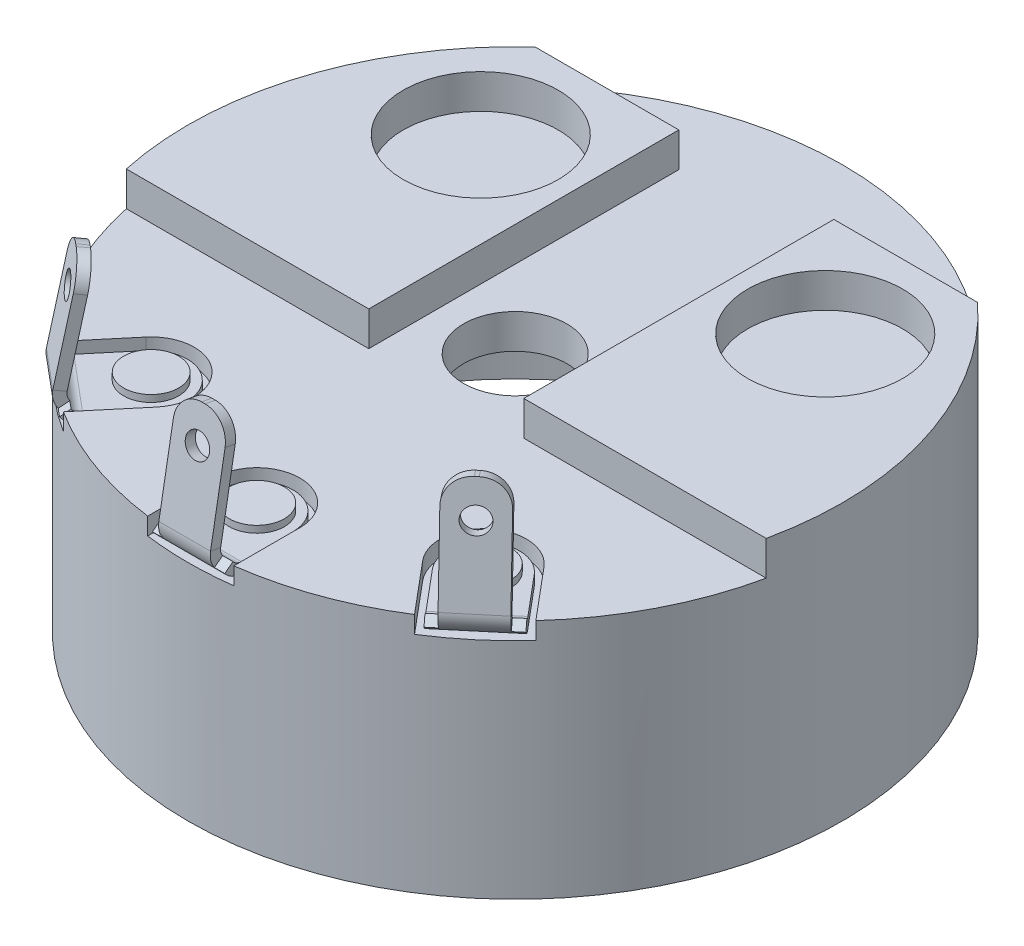
from build123d import *

# Parameters (mm, degrees)
SKETCH1_R                  = 4.75
SKETCH1_R_2                = 0.75
BOSS_EXTRUDE1_DEPTH        = 0.5
BOSS_EXTRUDE2_START        = 0.5
SKETCH1_3_R                = 1.125
BOSS_EXTRUDE2_DEPTH        = 0.5
SKETCH2_R                  = 0.375
CUT_EXTRUDE1_DEPTH         = 7.736096793
CUT_EXTRUDE2_DEPTH         = 0.25
CIRPATTERN2_COUNT          = 3
CIRPATTERN2_ANGLE          = 80
EXTRUDE_THIN2_START        = -0.5
SKETCH1_5_R                = 4.75
SKETCH1_5_R_2              = 4.5
EXTRUDE_THIN2_DEPTH        = 3
BASE_FLANGE2_START         = 0.15
SKETCH6_R                  = 0.175
SKETCH6_R_2                = 0.375
BASE_FLANGE2_DEPTH         = 0.15
SKETCHED_START             = -0.525
SKETCHED_BEND1_DEPTH       = 1.05
SKETCHED_BEND1_2_DEPTH     = 0.15
SKETCHED_START_2           = 0.375
SKETCHED_BEND1_3_DEPTH     = 0.15
SKETCHED_BEND1_4_DEPTH     = 1.05
SKETCHED_START_3           = -0.375
SKETCHED_BEND1_5_DEPTH     = 0.75
SKETCHED_START_4           = -4.741475404
SKETCHED_BEND1_6_OUTLINE_R = 0.175
SKETCHED_BEND1_6_DEPTH     = 0.149999999
SKETCH16_R                 = 0.375
BASE_FLANGE3_DEPTH         = 0.15
CIRPATTERN3_COUNT          = 3
CIRPATTERN3_ANGLE          = 80


with BuildPart() as part:
    # Sketch1 → Boss-Extrude1 (new body)
    with BuildSketch(Plane(origin=(0, 0, 0), x_dir=(1, 0, 0), z_dir=(0, 1, 0))):
        with Locations(Location((0, 0, 0), (0, 0, 270))):
            Circle(SKETCH1_R)
        with Locations(Location((0, 0, 0), (0, 0, 270))):
            Circle(SKETCH1_R_2, mode=Mode.SUBTRACT)
    extrude(amount=-BOSS_EXTRUDE1_DEPTH)

    # Sketch1<3> → Boss-Extrude2 (add)
    # profile 1 of 2: a face of its own
    with BuildSketch(Plane(origin=(0, 0, 0), x_dir=(1, 0, 0), z_dir=(0, 1, 0)).offset(BOSS_EXTRUDE2_START)):
        with BuildLine():
            ThreePointArc((-3.211308145, 3.5), (-4.526276083, 1.440598771), (-4.643543905, -1))
            Line((-4.643543905, -1), (-1.125, -1))
            Line((-1.125, -1), (-1.125, 3.5))
            Line((-1.125, 3.5), (-3.211308145, 3.5))
        make_face()
        with Locations(Location((-2.5, 2, 0), (0, 0, 270))):
            Circle(SKETCH1_3_R, mode=Mode.SUBTRACT)
    # profile 2 of 2: a face of its own
    with BuildSketch(Plane(origin=(0, 0, 0), x_dir=(1, 0, 0), z_dir=(0, 1, 0)).offset(BOSS_EXTRUDE2_START)):
        with BuildLine():
            Line((1.125, -1), (4.643543905, -1))
            ThreePointArc((4.643543905, -1), (4.723310997, -0.502825243), (4.75, 0))
            ThreePointArc((4.75, 0), (4.348345299, 1.911646713), (3.211308145, 3.5))
            Line((3.211308145, 3.5), (1.125, 3.5))
            Line((1.125, 3.5), (1.125, -1))
        make_face()
        with Locations(Location((2.5, 2, 0), (0, 0, 270))):
            Circle(SKETCH1_3_R, mode=Mode.SUBTRACT)
    extrude(amount=-BOSS_EXTRUDE2_DEPTH)

    # Sketch2 → Cut-Extrude1 (cut, through all)
    with BuildSketch(Plane(origin=(0, 0, 0), x_dir=(1, 0, 0), z_dir=(0, 1, 0))):
        with Locations(Location((-2.410453536, -2.872666662, 0), (0, 0, 270))):
            Circle(SKETCH2_R)
    cut_extrude1 = extrude(amount=-CUT_EXTRUDE1_DEPTH, mode=Mode.SUBTRACT)

    # Sketch2<3> → Cut-Extrude2 (cut)
    with BuildSketch(Plane(origin=(0, 0, 0), x_dir=(1, 0, 0), z_dir=(0, 1, 0))):
        with BuildLine():
            Line((-3.505473113, -3.205332784), (-2.889231313, -2.470924406))
            ThreePointArc((-2.889231313, -2.470924406), (-2.00871128, -2.393888885), (-1.931675759, -3.274408918))
            Line((-1.931675759, -3.274408918), (-2.547917559, -4.008817296))
            ThreePointArc((-2.547917559, -4.008817296), (-3.053241146, -3.638711105), (-3.505473113, -3.205332784))
        make_face()
    cut_extrude2 = extrude(amount=-CUT_EXTRUDE2_DEPTH, mode=Mode.SUBTRACT)

    # CirPattern2: Cut-Extrude1, Cut-Extrude2 ×3 about axis
    cirpattern2_axis = Axis((0, 0, 0), (0, 1, 0))
    add([cut_extrude1.rotate(cirpattern2_axis, i * CIRPATTERN2_ANGLE / (CIRPATTERN2_COUNT - 1)) for i in range(1, CIRPATTERN2_COUNT)], mode=Mode.SUBTRACT)
    add([cut_extrude2.rotate(cirpattern2_axis, i * CIRPATTERN2_ANGLE / (CIRPATTERN2_COUNT - 1)) for i in range(1, CIRPATTERN2_COUNT)], mode=Mode.SUBTRACT)

    # Sketch1<5> → Extrude-Thin2 (add)
    with BuildSketch(Plane(origin=(0, 0, 0), x_dir=(1, 0, 0), z_dir=(0, 1, 0)).offset(EXTRUDE_THIN2_START)):
        Circle(SKETCH1_5_R)
        Circle(SKETCH1_5_R_2, mode=Mode.SUBTRACT)
    extrude(amount=-EXTRUDE_THIN2_DEPTH)


with BuildPart() as body_2:
    # Base-Flange2: sheet metal written as solids
    # Sketch6 → Base-Flange2 (new body)
    with BuildSketch(Plane(origin=(0, -0.25, 0), x_dir=(1, 0, 0), z_dir=(0, 1, 0)).offset(BASE_FLANGE2_START)):
        with BuildLine():
            Line((-3.428868668, -3.269611545), (-2.812626869, -2.535203167))
            ThreePointArc((-2.812626869, -2.535203167), (-2.072990041, -2.470493329), (-2.008280204, -3.210130157))
            Line((-2.008280204, -3.210130157), (-2.624522003, -3.944538535))
            Line((-2.624522003, -3.944538535), (-2.73942867, -3.848120394))
            Line((-2.73942867, -3.848120394), (-3.639331323, -4.920582614))
            ThreePointArc((-3.639331323, -4.920582614), (-3.876942368, -5.044275095), (-4.132422542, -4.963722506))
            Line((-4.132422542, -4.963722506), (-4.170724764, -4.931583125))
            ThreePointArc((-4.170724764, -4.931583125), (-4.294417245, -4.69397208), (-4.213864655, -4.438491907))
            Line((-4.213864655, -4.438491907), (-3.313962002, -3.366029686))
            Line((-3.313962002, -3.366029686), (-3.428868668, -3.269611545))
        make_face()
        with Locations(Location((-3.830179848, -4.564630594, 0), (0, 0, 270))):
            Circle(SKETCH6_R, mode=Mode.SUBTRACT)
        with Locations(Location((-2.410453536, -2.872666662, 0), (0, 0, 270))):
            Circle(SKETCH6_R_2, mode=Mode.SUBTRACT)
    extrude(amount=-BASE_FLANGE2_DEPTH)

    # Sketched Bend1: read off the stored shape, not the designer's step
    # Sketched Bend1 outline → Sketched Bend1 (cut)
    with BuildSketch(Plane(origin=(0, 0, 0), x_dir=(0.642787609686532, 0, -0.7660444431189841), z_dir=(0.7660444431189841, 0, 0.6427876096865321)).offset(SKETCHED_START)):
        with BuildLine():
            Line((-4.760983594, -0.1), (-6.45870205, -0.1))
            Line((-6.45870205, -0.1), (-6.45870205, -0.25))
            Line((-6.45870205, -0.25), (-4.501175973, -0.25))
            ThreePointArc((-4.501175973, -0.25), (-4.651175973, -0.209807621), (-4.760983594, -0.1))
        make_face()
    extrude(amount=SKETCHED_BEND1_DEPTH, mode=Mode.SUBTRACT)

    # Sketched Bend1 2 outline → Sketched Bend1 2 (cut)
    with BuildSketch(Plane(origin=(0, 0, 0), x_dir=(0.642787609686532, 0, -0.7660444431189841), z_dir=(0.7660444431189841, 0, 0.6427876096865321)).offset(SKETCHED_START)):
        Polygon((-4.70870205, -0.107257954), (-4.699124063, -0.1), (-4.70870205, -0.1), align=None)
    extrude(amount=SKETCHED_BEND1_2_DEPTH, mode=Mode.SUBTRACT)

    # Sketched Bend1 3 outline → Sketched Bend1 3 (cut)
    with BuildSketch(Plane(origin=(0, 0, 0), x_dir=(0.642787609686532, 0, -0.7660444431189841), z_dir=(0.7660444431189841, 0, 0.6427876096865321)).offset(SKETCHED_START_2)):
        Polygon((-4.70870205, -0.107257954), (-4.699124063, -0.1), (-4.70870205, -0.1), align=None)
    extrude(amount=SKETCHED_BEND1_3_DEPTH, mode=Mode.SUBTRACT)

    # Sketched Bend1 4 outline → Sketched Bend1 4 (add)
    with BuildSketch(Plane(origin=(0, 0, 0), x_dir=(0.642787609686532, 0, -0.7660444431189841), z_dir=(0.7660444431189841, 0, 0.6427876096865321)).offset(SKETCHED_START)):
        with BuildLine():
            ThreePointArc((-4.501175973, -0.1), (-4.567925274, -0.084329932), (-4.620728362, -0.040593743))
            Line((-4.620728362, -0.040593743), (-4.699124063, -0.1))
            Line((-4.699124063, -0.1), (-4.501175973, -0.1))
        make_face()
        with BuildLine():
            Line((-4.70870205, -0.166640087), (-4.70870205, -0.107257954))
            Line((-4.70870205, -0.107257954), (-4.740280751, -0.131187486))
            ThreePointArc((-4.740280751, -0.131187486), (-4.725193834, -0.149539465), (-4.70870205, -0.166640087))
        make_face()
    extrude(amount=SKETCHED_BEND1_4_DEPTH)

    # Sketched Bend1 5 outline → Sketched Bend1 5 (add)
    with BuildSketch(Plane(origin=(0, 0, 0), x_dir=(0.642787609686532, 0, -0.7660444431189841), z_dir=(0.7660444431189841, 0, 0.6427876096865321)).offset(SKETCHED_START_3)):
        with BuildLine():
            ThreePointArc((-4.620728362, -0.040593743), (-4.646984295, 0.014787316), (-4.648897136, 0.076047227))
            Line((-4.648897136, 0.076047227), (-4.377167779, 1.617100985))
            Line((-4.377167779, 1.617100985), (-4.524888942, 1.643148211))
            Line((-4.524888942, 1.643148211), (-4.796618299, 0.102094453))
            ThreePointArc((-4.796618299, 0.102094453), (-4.796618299, -0.002094454), (-4.760983594, -0.1))
            Line((-4.760983594, -0.1), (-4.699124063, -0.1))
            Line((-4.699124063, -0.1), (-4.620728362, -0.040593743))
        make_face()
    extrude(amount=SKETCHED_BEND1_5_DEPTH)

    # Sketched Bend1 6 outline → Sketched Bend1 6 (cut)
    with BuildSketch(Plane(origin=(0, 0, 0), x_dir=(0.7741336234862156, 0.1419950663058049, 0.6168910228986253), z_dir=(0.6330222215594821, -0.17364817766693402, -0.7544065067354941)).offset(SKETCHED_START_4)):
        with BuildLine():
            Line((-0.251054745, -0.877817458), (0.095287988, -0.827352508))
            ThreePointArc((0.095287988, -0.827352508), (-0.164394149, -0.761595178), (-0.301519694, -0.531474724))
            Line((-0.301519694, -0.531474724), (-0.251054745, -0.877817458))
        make_face()
        with BuildLine():
            ThreePointArc((0.440643306, -0.423335547), (0.374885975, -0.683017684), (0.144765522, -0.82014323))
            Line((0.144765522, -0.82014323), (0.491108255, -0.769678281))
            Line((0.491108255, -0.769678281), (0.440643306, -0.423335547))
        make_face()
        with Locations((0.04793397, -0.328972536)):
            Circle(SKETCHED_BEND1_6_OUTLINE_R)
    extrude(amount=SKETCHED_BEND1_6_DEPTH, mode=Mode.SUBTRACT)


with BuildPart() as body_3:
    # Base-Flange3: sheet metal written as solids
    # Sketch16 → Base-Flange3 (new body)
    with BuildSketch(Plane.XZ.offset(0.5)):
        with BuildLine():
            ThreePointArc((-2.828265483, 3.37059555), (0, -4.4), (2.828265483, 3.37059555))
            ThreePointArc((2.828265483, 3.37059555), (1.912524648, 3.290478608), (1.99264159, 2.374737774))
            ThreePointArc((1.99264159, 2.374737774), (0, -3.1), (-1.99264159, 2.374737774))
            ThreePointArc((-1.99264159, 2.374737774), (-1.912524648, 3.290478608), (-2.828265483, 3.37059555))
        make_face()
        with Locations(Location((2.410453536, 2.872666662, 0), (0, 0, 270))):
            Circle(SKETCH16_R, mode=Mode.SUBTRACT)
        with Locations(Location((-2.410453536, 2.872666662, 0), (0, 0, 270))):
            Circle(SKETCH16_R, mode=Mode.SUBTRACT)
    extrude(amount=BASE_FLANGE3_DEPTH)


with BuildPart() as body_4:
    # Sketch19 → Revolve1 (revolve)
    with BuildSketch(Plane(origin=(0, 0, 0), x_dir=(-0.6427876096865404, 0, 0.7660444431189771), z_dir=(-0.7660444431189771, 0, -0.6427876096865404)), mode=Mode.PRIVATE) as revolve1_sk:
        Polygon((3.375, -0.1), (3.35, -0.1), (3.35, 0), (3.75, 0), (3.75, -0.75), (3.35, -0.75), (3.35, -0.65), (3.375, -0.65), align=None)
    revolve(revolve1_sk.sketch.rotate(Axis((-2.410453536, 0, 2.872666662), (0, -1, 0)), 140), axis=Axis((-2.410453536, 0, 2.872666662), (0, -1, 0)))


with BuildPart() as cirpattern3_1:
    # CirPattern3: pattern copy
    add(body_4.part.rotate(Axis((0, 0, 0), (0, 1, 0)), 1 * CIRPATTERN3_ANGLE / (CIRPATTERN3_COUNT - 1)))


with BuildPart() as cirpattern3_2:
    # CirPattern3: pattern copy
    add(body_4.part.rotate(Axis((0, 0, 0), (0, 1, 0)), 2 * CIRPATTERN3_ANGLE / (CIRPATTERN3_COUNT - 1)))


with BuildPart() as cirpattern3_3:
    # CirPattern3: pattern copy
    add(body_2.part.rotate(Axis((0, 0, 0), (0, 1, 0)), 1 * CIRPATTERN3_ANGLE / (CIRPATTERN3_COUNT - 1)))


with BuildPart() as cirpattern3_4:
    # CirPattern3: pattern copy
    add(body_2.part.rotate(Axis((0, 0, 0), (0, 1, 0)), 2 * CIRPATTERN3_ANGLE / (CIRPATTERN3_COUNT - 1)))


solid = Compound([part.part, body_2.part, body_3.part, body_4.part, cirpattern3_1.part, cirpattern3_2.part, cirpattern3_3.part, cirpattern3_4.part])
